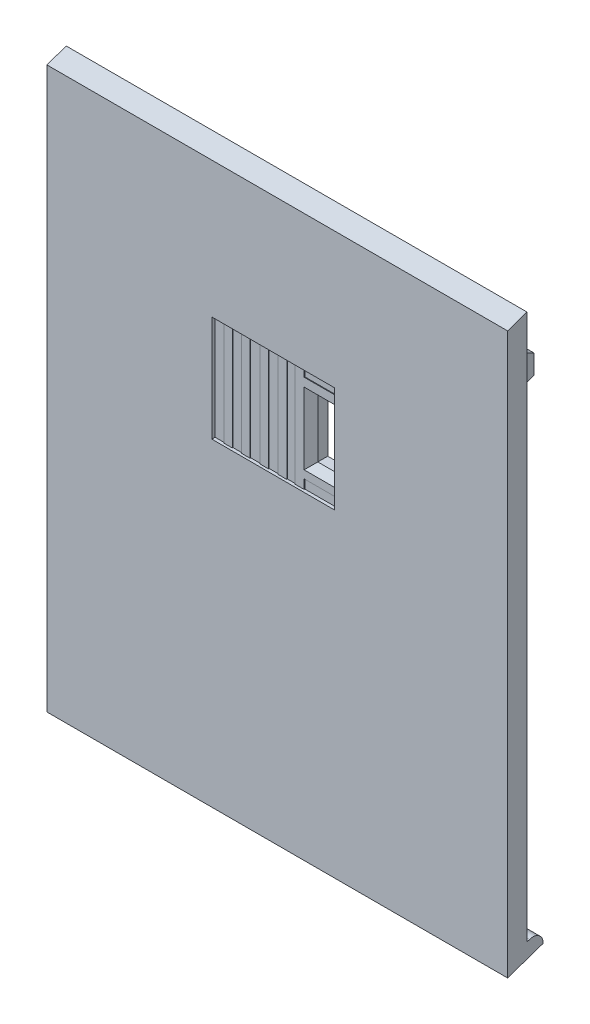
from build123d import *
from OCP.BRepFilletAPI import BRepFilletAPI_MakeChamfer

# Parameters (mm, degrees)
SALIENTE_EXTRUIR1_START   = -112.716536218
SALIENTE_EXTRUIR1_DEPTH   = 135
SALIENTE_EXTRUIR2_START   = -105.966536218
SALIENTE_EXTRUIR2_DEPTH   = 3
SALIENTE_EXTRUIR2_START_2 = 12.533463782
SALIENTE_EXTRUIR2_2_DEPTH = 3
SALIENTE_EXTRUIR2_START_3 = -102.966536218
SALIENTE_EXTRUIR2_3_DEPTH = 115.5
SALIENTE_EXTRUIR2_START_4 = -109.155348963
SALIENTE_EXTRUIR2_4_DEPTH = 3
SALIENTE_EXTRUIR2_START_5 = 15.722276527
SALIENTE_EXTRUIR2_5_DEPTH = 3
SALIENTE_EXTRUIR2_START_6 = -106.155348963
SALIENTE_EXTRUIR2_6_DEPTH = 0.188812745
SALIENTE_EXTRUIR2_START_7 = 15.533463782
SALIENTE_EXTRUIR2_7_DEPTH = 0.188812745
CORTAR_EXTRUIR1_DEPTH     = 142
SALIENTE_EXTRUIR3_START   = -67.100694653
SALIENTE_EXTRUIR3_DEPTH   = 43.76831687
CORTAR_EXTRUIR2_DEPTH     = 52
CHAFL_N1_SIZE             = 1
CHAFL_N1_SIZE2            = 0.786933748
CHAFL_N2_SIZE             = 1
CHAFL_N2_SIZE2            = 1.611265726
CHAFL_N3_SIZE             = 4
CHAFL_N3_SIZE2            = 3.141527632
CORTAR_EXTRUIR3_DEPTH     = 243
CHAFL_N4_SIZE             = 2
CHAFL_N4_SIZE2            = 1.425175398
CROQUIS7_W                = 135
CROQUIS7_H                = 4.35404101
SALIENTE_EXTRUIR4_DEPTH   = 5
REDONDEO1_R               = 3
SALIENTE_EXTRUIR5_DEPTH   = 8
CORTAR_EXTRUIR4_DEPTH     = 16
REDONDEO2_R               = 3
CORTAR_EXTRUIR5_START     = -9.75
CORTAR_EXTRUIR5_DEPTH     = 115.5
CROQUIS11_R               = 3.5
CROQUIS11_R_2             = 2
CROQUIS11_R_3             = 3
CROQUIS11_R_4             = 1.25
SALIENTE_EXTRUIR6_DEPTH   = 5
CROQUIS13_W               = 36
CROQUIS13_H               = 31
CORTAR_EXTRUIR6_DEPTH     = 0.75
CROQUIS15_W               = 7
CROQUIS15_H               = 17
CORTAR_EXTRUIR7_DEPTH     = 7.75
CHAFL_N5_SIZE             = 2
CHAFL_N6_SIZE             = 2
CHAFL_N7_SIZE             = 2
CROQUIS16_W               = 2.35582371
CROQUIS16_H               = 31
CROQUIS16_W_2             = 2.706691071
CROQUIS16_W_3             = 2.907186706
CROQUIS16_W_4             = 2.885910706
CROQUIS16_W_5             = 9.7
CROQUIS16_H_2             = 2.702756478
CROQUIS16_H_3             = 2.520677697
CORTAR_EXTRUIR8_DEPTH     = 0.2
CHAFL_N8_SIZE             = 2


# Read off the part's stored shape, not the designer's step: Saliente-Extruir1, Saliente-Extruir2, Saliente-Extruir3
with BuildPart() as part:
    # Saliente-Extruir1 outline → Saliente-Extruir1 (new body)
    with BuildSketch(Plane.YZ.offset(SALIENTE_EXTRUIR1_START)):
        Polygon((-94.607382532, 5.674155302), (-92.657007797, 0), (71.548186707, 0), (69.597811972, 5.674155302), align=None)
    extrude(amount=SALIENTE_EXTRUIR1_DEPTH)

    # Saliente-Extruir2 outline → Saliente-Extruir2 (add)
    with BuildSketch(Plane.YZ.offset(SALIENTE_EXTRUIR2_START)):
        Polygon((-88.302966787, 0), (-86.352592053, -5.674155302), (53.883350011, -5.674155302), (51.932975277, 0), align=None)
    extrude(amount=SALIENTE_EXTRUIR2_DEPTH)

    # Saliente-Extruir2 2 outline → Saliente-Extruir2 2 (add)
    with BuildSketch(Plane.YZ.offset(SALIENTE_EXTRUIR2_START_2)):
        Polygon((-88.302966787, 0), (-86.352592053, -5.674155302), (53.883350011, -5.674155302), (51.932975277, 0), align=None)
    extrude(amount=SALIENTE_EXTRUIR2_2_DEPTH)

    # Saliente-Extruir2 3 outline → Saliente-Extruir2 3 (add)
    with BuildSketch(Plane.YZ.offset(SALIENTE_EXTRUIR2_START_3)):
        Polygon((-85.302966787, 0), (-88.302966787, 0), (-86.352592053, -5.674155302), (-83.352592053, -5.674155302), align=None)
    extrude(amount=SALIENTE_EXTRUIR2_3_DEPTH)

    # Saliente-Extruir2 4 outline → Saliente-Extruir2 4 (add)
    with BuildSketch(Plane.YZ.offset(SALIENTE_EXTRUIR2_START_4)):
        Polygon((48.932975277, 0), (50.883350011, -5.674155302), (63.313045378, -5.674155302), (61.362670643, 0), align=None)
    extrude(amount=SALIENTE_EXTRUIR2_4_DEPTH)

    # Saliente-Extruir2 5 outline → Saliente-Extruir2 5 (add)
    with BuildSketch(Plane.YZ.offset(SALIENTE_EXTRUIR2_START_5)):
        Polygon((48.932975277, 0), (50.883350011, -5.674155302), (63.313045378, -5.674155302), (61.362670643, 0), align=None)
    extrude(amount=SALIENTE_EXTRUIR2_5_DEPTH)

    # Saliente-Extruir2 6 outline → Saliente-Extruir2 6 (add)
    with BuildSketch(Plane.YZ.offset(SALIENTE_EXTRUIR2_START_6)):
        Polygon((51.932975277, 0), (48.932975277, 0), (50.883350011, -5.674155302), (53.883350011, -5.674155302), align=None)
    extrude(amount=SALIENTE_EXTRUIR2_6_DEPTH)

    # Saliente-Extruir2 7 outline → Saliente-Extruir2 7 (add)
    with BuildSketch(Plane.YZ.offset(SALIENTE_EXTRUIR2_START_7)):
        Polygon((51.932975277, 0), (48.932975277, 0), (50.883350011, -5.674155302), (53.883350011, -5.674155302), align=None)
    extrude(amount=SALIENTE_EXTRUIR2_7_DEPTH)

    # Croquis3 → Cortar-Extruir1 (cut)
    with BuildSketch(Plane(origin=(18.722276527, 0, 0), x_dir=(0, 0, -1), z_dir=(1, 0, 0))):
        Polygon((5.674155302, 59.663045378), (0, 57.686858925), (0, 61.691536691), (6.106990738, 63.936404196), (5.897646794, 59.689197808), align=None)
    extrude(amount=-CORTAR_EXTRUIR1_DEPTH, mode=Mode.SUBTRACT)

    # Saliente-Extruir3 outline → Saliente-Extruir3 (add)
    with BuildSketch(Plane.YZ.offset(SALIENTE_EXTRUIR3_START)):
        Polygon((67.89512648, -3.782770202), (66.594876657, 0), (64.112670643, 0), (65.412920466, -3.782770202), align=None)
    extrude(amount=SALIENTE_EXTRUIR3_DEPTH)

    # Croquis5 → Cortar-Extruir2 (cut)
    with BuildSketch(Plane.ZY.offset(67.100694653)):
        Polygon((0, 64.112670643), (-3.782770202, 65.412920466), (-3.782770202, 65.812920466), (0, 64.512670643), align=None)
    extrude(amount=-CORTAR_EXTRUIR2_DEPTH, mode=Mode.SUBTRACT)

    # Chaflán1
    chafl_n1_edges = [part.edges().sort_by_distance(p)[0] for p in [
        (-45.216536218, 67.89512648, -3.782770202),
    ]]
    chafl_n1_side = [part.faces().sort_by_distance(p)[0] for p in [
        (-45.216536218, 67.245001569, -1.891385101),
    ]]
    chamfer(chafl_n1_edges, length=CHAFL_N1_SIZE, length2=CHAFL_N1_SIZE2, reference=chafl_n1_side[0])

    # Chaflán2
    chafl_n2_edges = [part.edges().sort_by_distance(p)[0] for p in [
        (-45.216536218, 65.812920466, -3.782770202),
    ]]
    chafl_n2_side = [part.faces().sort_by_distance(p)[0] for p in [
        (-45.216536218, 66.460556599, -3.782770202),
    ]]
    chamfer(chafl_n2_edges, length=CHAFL_N2_SIZE, length2=CHAFL_N2_SIZE2, reference=chafl_n2_side[0])

    # Chaflán3: one chamfer whose edges measure the first distance from different faces: ONE call of the kernel's chamfer builder (chamfer() names one face for all edges)
    chafl_n3_edges_1 = [part.edges().sort_by_distance(p)[0] for p in [
        (17.222276527, 59.663045378, -5.674155302),
    ]]
    chafl_n3_side_1 = [part.faces().sort_by_distance(p)[0] for p in [
        (17.222276527, 58.674952151, -2.837077651),
    ]]
    chafl_n3_edges_2 = [part.edges().sort_by_distance(p)[0] for p in [
        (-107.655348963, 59.663045378, -5.674155302),
    ]]
    chafl_n3_side_2 = [part.faces().sort_by_distance(p)[0] for p in [
        (-107.655348963, 58.674952151, -2.837077651),
    ]]
    chafl_n3 = BRepFilletAPI_MakeChamfer(part.part.solid().wrapped)
    for e in chafl_n3_edges_1:
        chafl_n3.Add(CHAFL_N3_SIZE, CHAFL_N3_SIZE2, e.wrapped, chafl_n3_side_1[0].wrapped)  # the first distance lies on this face
    for e in chafl_n3_edges_2:
        chafl_n3.Add(CHAFL_N3_SIZE, CHAFL_N3_SIZE2, e.wrapped, chafl_n3_side_2[0].wrapped)  # the first distance lies on this face
    add(Compound.cast(chafl_n3.Shape()), mode=Mode.REPLACE)

    # Croquis6 → Cortar-Extruir3 (cut)
    with BuildSketch(Plane(origin=(15.533463782, 0, 0), x_dir=(0, 0, -1), z_dir=(1, 0, 0))):
        Polygon((1.138067307, -87.911779447), (5.674155302, -74.677839868), (7.462563926, -80.875468684), (5.674155302, -88.836341828), (1.028411824, -88.836341828), align=None)
    extrude(amount=-CORTAR_EXTRUIR3_DEPTH, mode=Mode.SUBTRACT)

    # Chaflán4
    chafl_n4_edges = [part.edges().sort_by_distance(p)[0] for p in [
        (-45.216536218, -84.511123218, -2.303682112),
    ]]
    chafl_n4_side = [part.faces().sort_by_distance(p)[0] for p in [
        (-45.216536218, -85.384648624, -2.004271034),
    ]]
    chamfer(chafl_n4_edges, length=CHAFL_N4_SIZE, length2=CHAFL_N4_SIZE2, reference=chafl_n4_side[0])

    # Croquis7 → Saliente-Extruir4 (add, along a direction that is not the sketch's normal)
    with BuildSketch(Plane(origin=(0, 0, 0), x_dir=(-1, 0, 0), z_dir=(0, 0, -1))):
        with Locations((45.216536218, -90.479987292)):
            Rectangle(CROQUIS7_W, CROQUIS7_H)
    extrude(amount=SALIENTE_EXTRUIR4_DEPTH, dir=(0, 0.3250624557733218, -0.9456925503812629))

    # Redondeo1
    # the kernel refuses this fillet: 3 mm, written as the material it takes off along each edge
    with BuildSketch(Plane(origin=(32.792131123, -86.677654508, -4.728462752), x_dir=(0, -0.325062455773321, 0.945692550381263), z_dir=(-1, 0, 0))) as redondeo1_piece_1_section:
        with BuildLine():
            CenterArc((REDONDEO1_R * 1.40115564539, -REDONDEO1_R), REDONDEO1_R, 90, 108.969358895)
            Line((REDONDEO1_R * 0.455463095012, -REDONDEO1_R * 1.32506245577), (0, 0))
            Line((0, 0), (REDONDEO1_R * 1.40115564539, 0))
        make_face()
    redondeo1_piece_1 = extrude(amount=156.017334681, mode=Mode.PRIVATE)
    redondeo1_piece_1 = split(redondeo1_piece_1, bisect_by=Plane(origin=(24.162797452, -87.99794968, -1.108531449), z_dir=(0, 0.3242435571173952, 0.945973633706489)), keep=Keep.TOP, mode=Mode.PRIVATE)
    redondeo1_piece_1 = split(redondeo1_piece_1, bisect_by=Plane(origin=(15.533463782, -87.946261659, -0.957732753), z_dir=(1, 0, 0)), keep=Keep.TOP, mode=Mode.PRIVATE)
    add(redondeo1_piece_1, mode=Mode.SUBTRACT)
    with BuildSketch(Plane(origin=(32.792131123, -86.677654508, -4.728462752), x_dir=(0, -0.325062455773321, 0.945692550381263), z_dir=(-1, 0, 0))) as redondeo1_piece_2_section:
        with BuildLine():
            CenterArc((REDONDEO1_R * 1.40115564539, -REDONDEO1_R), REDONDEO1_R, 90, 108.969358895)
            Line((REDONDEO1_R * 0.455463095012, -REDONDEO1_R * 1.32506245577), (0, 0))
            Line((0, 0), (REDONDEO1_R * 1.40115564539, 0))
        make_face()
    redondeo1_piece_2 = extrude(amount=156.017334681, mode=Mode.PRIVATE)
    redondeo1_piece_2 = split(redondeo1_piece_2, bisect_by=Plane(origin=(24.162797452, -87.17098593, -1.391982973), z_dir=(0, -0.3242435571173952, -0.945973633706489)), keep=Keep.TOP, mode=Mode.PRIVATE)
    redondeo1_piece_2 = split(redondeo1_piece_2, bisect_by=Plane(origin=(15.533463782, -87.997966874, -3.804682167), z_dir=(1, 0, 0)), keep=Keep.TOP, mode=Mode.PRIVATE)
    add(redondeo1_piece_2, mode=Mode.SUBTRACT)
    with BuildSketch(Plane(origin=(32.792131123, -86.677654508, -4.728462752), x_dir=(0, -0.325062455773321, 0.945692550381263), z_dir=(-1, 0, 0))) as redondeo1_piece_3_section:
        with BuildLine():
            CenterArc((REDONDEO1_R * 1.40115564539, -REDONDEO1_R), REDONDEO1_R, 90, 108.969358895)
            Line((REDONDEO1_R * 0.455463095012, -REDONDEO1_R * 1.32506245577), (0, 0))
            Line((0, 0), (REDONDEO1_R * 1.40115564539, 0))
        make_face()
    redondeo1_piece_3 = extrude(amount=156.017334681, mode=Mode.PRIVATE)
    redondeo1_piece_3 = split(redondeo1_piece_3, bisect_by=Plane(origin=(-45.216536218, -87.17098593, -1.391982973), z_dir=(0, -0.3242435571173952, -0.945973633706489)), keep=Keep.TOP, mode=Mode.PRIVATE)
    redondeo1_piece_3 = split(redondeo1_piece_3, bisect_by=Plane(origin=(15.533463782, -87.997966874, -3.804682167), z_dir=(-1, 0, 0)), keep=Keep.TOP, mode=Mode.PRIVATE)
    redondeo1_piece_3 = split(redondeo1_piece_3, bisect_by=Plane(origin=(-105.966536218, -87.997966874, -3.804682167), z_dir=(1, 0, 0)), keep=Keep.TOP, mode=Mode.PRIVATE)
    add(redondeo1_piece_3, mode=Mode.SUBTRACT)
    with BuildSketch(Plane(origin=(32.792131123, -86.677654508, -4.728462752), x_dir=(0, -0.325062455773321, 0.945692550381263), z_dir=(-1, 0, 0))) as redondeo1_piece_4_section:
        with BuildLine():
            CenterArc((REDONDEO1_R * 1.40115564539, -REDONDEO1_R), REDONDEO1_R, 90, 108.969358895)
            Line((REDONDEO1_R * 0.455463095012, -REDONDEO1_R * 1.32506245577), (0, 0))
            Line((0, 0), (REDONDEO1_R * 1.40115564539, 0))
        make_face()
    redondeo1_piece_4 = extrude(amount=156.017334681, mode=Mode.PRIVATE)
    redondeo1_piece_4 = split(redondeo1_piece_4, bisect_by=Plane(origin=(-114.595869888, -87.99794968, -1.108531449), z_dir=(0, 0.3242435571173952, 0.945973633706489)), keep=Keep.TOP, mode=Mode.PRIVATE)
    redondeo1_piece_4 = split(redondeo1_piece_4, bisect_by=Plane(origin=(-105.966536218, -87.946261659, -0.957732753), z_dir=(-1, 0, 0)), keep=Keep.TOP, mode=Mode.PRIVATE)
    add(redondeo1_piece_4, mode=Mode.SUBTRACT)
    with BuildSketch(Plane(origin=(32.792131123, -86.677654508, -4.728462752), x_dir=(0, -0.325062455773321, 0.945692550381263), z_dir=(-1, 0, 0))) as redondeo1_piece_5_section:
        with BuildLine():
            CenterArc((REDONDEO1_R * 1.40115564539, -REDONDEO1_R), REDONDEO1_R, 90, 108.969358895)
            Line((REDONDEO1_R * 0.455463095012, -REDONDEO1_R * 1.32506245577), (0, 0))
            Line((0, 0), (REDONDEO1_R * 1.40115564539, 0))
        make_face()
    redondeo1_piece_5 = extrude(amount=156.017334681, mode=Mode.PRIVATE)
    redondeo1_piece_5 = split(redondeo1_piece_5, bisect_by=Plane(origin=(-114.595869888, -87.17098593, -1.391982973), z_dir=(0, -0.3242435571173952, -0.945973633706489)), keep=Keep.TOP, mode=Mode.PRIVATE)
    redondeo1_piece_5 = split(redondeo1_piece_5, bisect_by=Plane(origin=(-105.966536218, -87.997966874, -3.804682167), z_dir=(-1, 0, 0)), keep=Keep.TOP, mode=Mode.PRIVATE)
    add(redondeo1_piece_5, mode=Mode.SUBTRACT)

    # Croquis8 → Saliente-Extruir5 (add)
    with BuildSketch(Plane(origin=(0, 0, 0), x_dir=(-1, 0, 0), z_dir=(0, 0, -1))):
        Polygon((39.180876317, -2.605289364), (39.180876317, -47.959276742), (50.680876317, -47.959276742), (50.680876317, -2.605289364), (44.930876317, -2.605289364), align=None)
    extrude(amount=SALIENTE_EXTRUIR5_DEPTH)

    # Croquis9 → Cortar-Extruir4 (cut)
    with BuildSketch(Plane.ZY.offset(50.680876317)):
        with BuildLine():
            Line((-5.944216718, -6.205289364), (-5.944216718, -44.359276742))
            ThreePointArc((-5.944216718, -44.359276742), (-4, -46.30349346), (-2.055783282, -44.359276742))
            Line((-2.055783282, -44.359276742), (-2.055783282, -6.205289364))
            ThreePointArc((-2.055783282, -6.205289364), (-4, -4.261072646), (-5.944216718, -6.205289364))
        make_face()
    extrude(amount=-CORTAR_EXTRUIR4_DEPTH, mode=Mode.SUBTRACT)

    # Redondeo2
    redondeo2_edges = [part.edges().sort_by_distance(p)[0] for p in [
        (-44.930876317, -2.605289364, -8),
        (-44.930876317, -47.959276742, -8),
    ]]
    fillet(redondeo2_edges, radius=REDONDEO2_R)

    # Croquis10 → Cortar-Extruir5 (cut)
    with BuildSketch(Plane(origin=(22.283463782, 0, 0), x_dir=(0, 0, -1), z_dir=(1, 0, 0)).offset(CORTAR_EXTRUIR5_START)):
        with BuildLine():
            Line((0, -88.302966787), (0, -83.901289326))
            Line((0, -83.901289326), (-1.556763584, -83.901289326))
            Line((-1.556763584, -83.901289326), (-1.556763584, -89.434140922))
            Line((-1.556763584, -89.434140922), (4.356436756, -89.434140922))
            ThreePointArc((4.356436756, -89.434140922), (2.808286082, -88.082196369), (0.753275385, -88.044043793))
            Line((0.753275385, -88.044043793), (0, -88.302966787))
        make_face()
        with BuildLine():
            Line((1.333248246, -84.585765812), (0, -83.901289326))
            Line((0, -83.901289326), (0, -88.302966787))
            Line((0, -88.302966787), (0.753275385, -88.044043793))
            ThreePointArc((0.753275385, -88.044043793), (2.808286082, -88.082196369), (4.356436756, -89.434140922))
            Line((4.356436756, -89.434140922), (4.565498319, -89.434140922))
            Line((4.565498319, -89.434140922), (1.333248246, -84.585765812))
        make_face()
    extrude(amount=-CORTAR_EXTRUIR5_DEPTH, mode=Mode.SUBTRACT)

    # Croquis11 → Saliente-Extruir6 (add)
    # profile 1 of 12: a face of its own
    with BuildSketch(Plane(origin=(0, 0, 0), x_dir=(-1, 0, 0), z_dir=(0, 0, -1))):
        with Locations((60.709838886, 42.969385763)):
            Circle(CROQUIS11_R)
        with Locations((60.709838886, 42.969385763)):
            Circle(CROQUIS11_R_2, mode=Mode.SUBTRACT)
    # profile 2 of 12: a face of its own
    with BuildSketch(Plane(origin=(0, 0, 0), x_dir=(-1, 0, 0), z_dir=(0, 0, -1))):
        with Locations((5.083838886, 42.969385763)):
            Circle(CROQUIS11_R)
        with Locations((5.083838886, 42.969385763)):
            Circle(CROQUIS11_R_2, mode=Mode.SUBTRACT)
    # profile 3 of 12: a face of its own
    with BuildSketch(Plane(origin=(0, 0, 0), x_dir=(-1, 0, 0), z_dir=(0, 0, -1))):
        with Locations((64.291068708, 21.849098622)):
            Circle(CROQUIS11_R)
        with Locations((64.291068708, 21.849098622)):
            Circle(CROQUIS11_R_2, mode=Mode.SUBTRACT)
    # profile 4 of 12: a face of its own
    with BuildSketch(Plane(origin=(0, 0, 0), x_dir=(-1, 0, 0), z_dir=(0, 0, -1))):
        with Locations((88.857267589, 21.849098622)):
            Circle(CROQUIS11_R)
        with Locations((88.857267589, 21.849098622)):
            Circle(CROQUIS11_R_2, mode=Mode.SUBTRACT)
    # profile 5 of 12: a face of its own
    with BuildSketch(Plane(origin=(0, 0, 0), x_dir=(-1, 0, 0), z_dir=(0, 0, -1))):
        with Locations((64.2780822, -24.646702878)):
            Circle(CROQUIS11_R_2)
    # profile 6 of 12: a face of its own
    with BuildSketch(Plane(origin=(0, 0, 0), x_dir=(-1, 0, 0), z_dir=(0, 0, -1))):
        with Locations((88.7780822, -24.646702878)):
            Circle(CROQUIS11_R_2)
    # profile 7 of 12: a face of its own
    with BuildSketch(Plane(origin=(0, 0, 0), x_dir=(-1, 0, 0), z_dir=(0, 0, -1))):
        with Locations((1.144671317, -46.93983138)):
            Circle(CROQUIS11_R)
        with Locations((1.144671317, -46.93983138)):
            Circle(CROQUIS11_R_2, mode=Mode.SUBTRACT)
    # profile 8 of 12: a face of its own
    with BuildSketch(Plane(origin=(0, 0, 0), x_dir=(-1, 0, 0), z_dir=(0, 0, -1))):
        with Locations((10.144671317, -46.93983138)):
            Circle(CROQUIS11_R)
        with Locations((10.144671317, -46.93983138)):
            Circle(CROQUIS11_R_2, mode=Mode.SUBTRACT)
    # profile 9 of 12: a face of its own
    with BuildSketch(Plane(origin=(0, 0, 0), x_dir=(-1, 0, 0), z_dir=(0, 0, -1))):
        with Locations((-3.289724073, 26.466046903)):
            Circle(CROQUIS11_R_3)
        with Locations((-3.289724073, 26.466046903)):
            Circle(CROQUIS11_R_4, mode=Mode.SUBTRACT)
    # profile 10 of 12: a face of its own
    with BuildSketch(Plane(origin=(0, 0, 0), x_dir=(-1, 0, 0), z_dir=(0, 0, -1))):
        with Locations((22.310275927, 26.466046903)):
            Circle(CROQUIS11_R_3)
        with Locations((22.310275927, 26.466046903)):
            Circle(CROQUIS11_R_4, mode=Mode.SUBTRACT)
    # profile 11 of 12: a face of its own
    with BuildSketch(Plane(origin=(0, 0, 0), x_dir=(-1, 0, 0), z_dir=(0, 0, -1))):
        with Locations((-3.289724073, -39.133953097)):
            Circle(CROQUIS11_R_3)
        with Locations((-3.289724073, -39.133953097)):
            Circle(CROQUIS11_R_4, mode=Mode.SUBTRACT)
    # profile 12 of 12: a face of its own
    with BuildSketch(Plane(origin=(0, 0, 0), x_dir=(-1, 0, 0), z_dir=(0, 0, -1))):
        with Locations((22.310275927, -39.133953097)):
            Circle(CROQUIS11_R_3)
        with Locations((22.310275927, -39.133953097)):
            Circle(CROQUIS11_R_4, mode=Mode.SUBTRACT)
    extrude(amount=SALIENTE_EXTRUIR6_DEPTH)

    # Croquis13 → Cortar-Extruir6 (cut)
    with BuildSketch(Plane.XY.offset(5.674155302)):
        with Locations((-46.391533261, 14.297374077)):
            Rectangle(CROQUIS13_W, CROQUIS13_H)
    extrude(amount=-CORTAR_EXTRUIR6_DEPTH, mode=Mode.SUBTRACT)

    # Croquis15 → Cortar-Extruir7 (cut)
    with BuildSketch(Plane.XY.offset(4.924155302)):
        with Locations((-32.591533261, 14.276680479)):
            Rectangle(CROQUIS15_W, CROQUIS15_H)
    extrude(amount=-CORTAR_EXTRUIR7_DEPTH, mode=Mode.SUBTRACT)

    # Chaflán5
    chafl_n5_edges = [part.edges().sort_by_distance(p)[0] for p in [
        (-32.591533261, 22.776680479, 4.924155302),
    ]]
    chamfer(chafl_n5_edges, length=CHAFL_N5_SIZE)

    # Chaflán6
    chafl_n6_edges = [part.edges().sort_by_distance(p)[0] for p in [
        (-32.591533261, 5.776680479, 4.924155302),
    ]]
    chamfer(chafl_n6_edges, length=CHAFL_N6_SIZE)

    # Chaflán7
    chafl_n7_edges = [part.edges().sort_by_distance(p)[0] for p in [
        (-36.091533261, 14.276680479, 4.924155302),
    ]]
    chamfer(chafl_n7_edges, length=CHAFL_N7_SIZE)

    # Croquis16 → Cortar-Extruir8 (cut)
    with BuildSketch(Plane.XY.offset(4.924155302)):
        with Locations((-41.982360106, 14.297374077)):
            Rectangle(CROQUIS16_W, CROQUIS16_H)
        with Locations((-47.17018466, 14.297374077)):
            Rectangle(CROQUIS16_W_2, CROQUIS16_H)
        with Locations((-52.533442893, 14.297374077)):
            Rectangle(CROQUIS16_W_3, CROQUIS16_H)
        with Locations((-57.79645331, 14.297374077)):
            Rectangle(CROQUIS16_W_2, CROQUIS16_H)
        with Locations((-62.948577908, 14.297374077)):
            Rectangle(CROQUIS16_W_4, CROQUIS16_H)
        with Locations((-33.241533261, 0.148752316)):
            Rectangle(CROQUIS16_W_5, CROQUIS16_H_2)
        with Locations((-33.241533261, 28.537035229)):
            Rectangle(CROQUIS16_W_5, CROQUIS16_H_3)
    extrude(amount=-CORTAR_EXTRUIR8_DEPTH, mode=Mode.SUBTRACT)

    # Chaflán8
    # the kernel refuses this chamfer: 2 mm, written as the material it takes off along each edge
    with BuildSketch(Plane(origin=(-29.091533261, -1.366685497, 4.924155302), x_dir=(-0.02749587661058563, 0, -0.9996219169112968), z_dir=(0, 1, 0))) as chafl_n8_piece_1_section:
        Polygon((CHAFL_N8_SIZE * 0.999621916911, -CHAFL_N8_SIZE * 0.0274958766106), (-CHAFL_N8_SIZE * 0.0274958766106, -CHAFL_N8_SIZE * 0.999621916911), (0, 0), align=None)
    chafl_n8_piece_1 = extrude(amount=31.286731952, mode=Mode.PRIVATE)
    chafl_n8_piece_1 = split(chafl_n8_piece_1, bisect_by=Plane(origin=(-28.768968375, 5.776680479, 4.314597533), z_dir=(0, -1, 0)), keep=Keep.TOP, mode=Mode.PRIVATE)
    chafl_n8_piece_1 = split(chafl_n8_piece_1, bisect_by=Plane(origin=(-28.768968375, 4.733848805, 3.966986976), z_dir=(0, 0.7071067811865476, 0.7071067811865476)), keep=Keep.TOP, mode=Mode.PRIVATE)
    chafl_n8_piece_1 = split(chafl_n8_piece_1, bisect_by=Plane(origin=(-28.391533261, 5.081459363, 4.314597533), z_dir=(-1, 0, 0)), keep=Keep.TOP, mode=Mode.PRIVATE)
    add(chafl_n8_piece_1, mode=Mode.SUBTRACT)
    with BuildSketch(Plane(origin=(-29.091533261, -1.366685497, 4.924155302), x_dir=(-0.02749587661058563, 0, -0.9996219169112968), z_dir=(0, 1, 0))) as chafl_n8_piece_2_section:
        Polygon((CHAFL_N8_SIZE * 0.999621916911, -CHAFL_N8_SIZE * 0.0274958766106), (-CHAFL_N8_SIZE * 0.0274958766106, -CHAFL_N8_SIZE * 0.999621916911), (0, 0), align=None)
    chafl_n8_piece_2 = extrude(amount=31.286731952, mode=Mode.PRIVATE)
    chafl_n8_piece_2 = split(chafl_n8_piece_2, bisect_by=Plane(origin=(-28.79384315, 5.776680479, 4.074342832), z_dir=(0, 1, 0)), keep=Keep.TOP, mode=Mode.PRIVATE)
    chafl_n8_piece_2 = split(chafl_n8_piece_2, bisect_by=Plane(origin=(-28.79384315, 22.776680479, 4.074342832), z_dir=(0, -1, 0)), keep=Keep.TOP, mode=Mode.PRIVATE)
    chafl_n8_piece_2 = split(chafl_n8_piece_2, bisect_by=Plane(origin=(-28.391533261, 14.276680479, 4.074342832), z_dir=(-1, 0, 0)), keep=Keep.TOP, mode=Mode.PRIVATE)
    add(chafl_n8_piece_2, mode=Mode.SUBTRACT)
    with BuildSketch(Plane(origin=(-29.091533261, -1.366685497, 4.924155302), x_dir=(-0.02749587661058563, 0, -0.9996219169112968), z_dir=(0, 1, 0))) as chafl_n8_piece_3_section:
        Polygon((CHAFL_N8_SIZE * 0.999621916911, -CHAFL_N8_SIZE * 0.0274958766106), (-CHAFL_N8_SIZE * 0.0274958766106, -CHAFL_N8_SIZE * 0.999621916911), (0, 0), align=None)
    chafl_n8_piece_3 = extrude(amount=31.286731952, mode=Mode.PRIVATE)
    chafl_n8_piece_3 = split(chafl_n8_piece_3, bisect_by=Plane(origin=(-28.768968375, 23.819512152, 3.966986976), z_dir=(0, -0.7071067811865476, 0.7071067811865476)), keep=Keep.TOP, mode=Mode.PRIVATE)
    chafl_n8_piece_3 = split(chafl_n8_piece_3, bisect_by=Plane(origin=(-28.768968375, 22.776680479, 4.314597533), z_dir=(0, 1, 0)), keep=Keep.TOP, mode=Mode.PRIVATE)
    chafl_n8_piece_3 = split(chafl_n8_piece_3, bisect_by=Plane(origin=(-28.391533261, 23.471901594, 4.314597533), z_dir=(-1, 0, 0)), keep=Keep.TOP, mode=Mode.PRIVATE)
    add(chafl_n8_piece_3, mode=Mode.SUBTRACT)


solid = part.part
